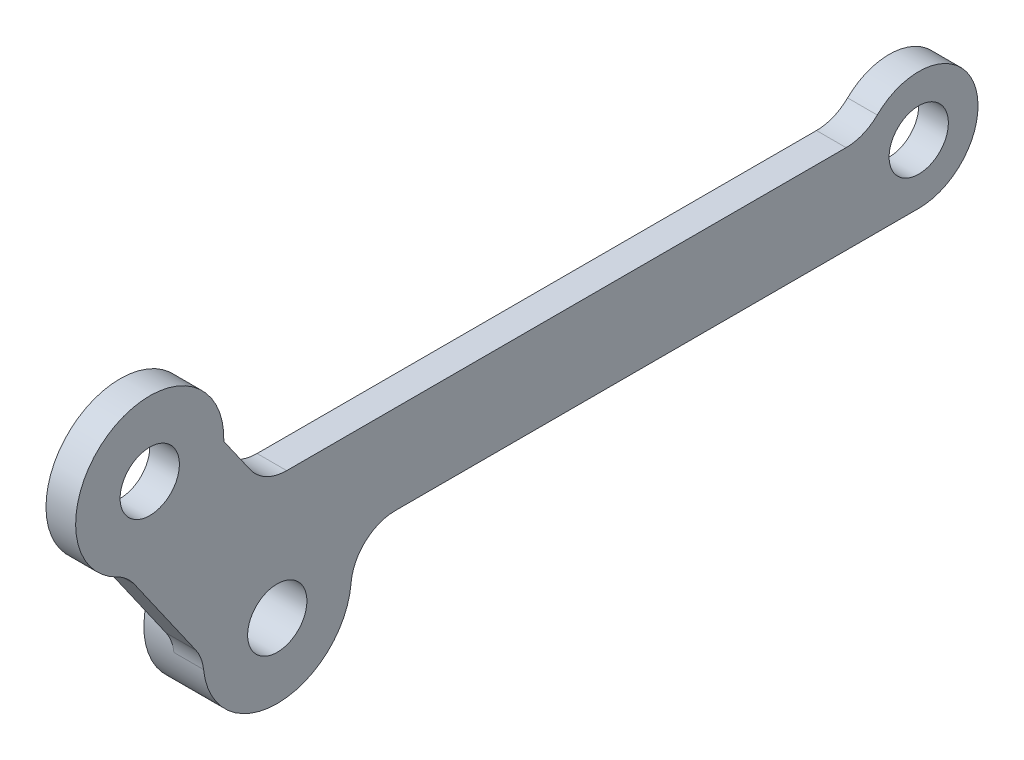
from build123d import *

# Parameters (mm, degrees)
EXTRUDE_1_DEPTH          = 2
EXTRUDE_START            = -2
SKETCH_1_4_R             = 5
EXTRUDE_2_DEPTH          = 2
CUT_EXTRUDE_1_DEPTH      = 51.040969284
CUT_EXTRUDE_1_DEPTH_BACK = 51.040969284
SKETCH_1_3_R             = 2
FILLET_1_R               = 3


with BuildPart() as part:
    # 草图1 → 凸台-拉伸1 (new body)
    with BuildSketch(Plane(origin=(0, 0, 0), x_dir=(0, 0, -1), z_dir=(1, 0, 0))):
        with BuildLine():
            Line((40.737143614, 0), (0, 0))
            Line((0, 0), (2.48051592, -3.542543867))
            ThreePointArc((2.48051592, -3.542543867), (4.165783411, -4.487079684), (5.367176995, -6))
            Line((5.367176995, -6), (44.201245229, -6))
            ThreePointArc((44.201245229, -6), (40.737143614, -4), (40.737143614, 0))
        make_face()
        with BuildLine():
            Line((2.48051592, -3.542543867), (0, 0))
            Line((0, 0), (-2.681672007, 3.829824531))
            ThreePointArc((-2.681672007, 3.829824531), (-4.811127311, -0.102785303), (-9.234888361, -0.758786959))
            Line((-9.234888361, -0.758786959), (-4.072700434, -8.131155358))
            ThreePointArc((-4.072700434, -8.131155358), (-1.94324513, -4.198545524), (2.48051592, -3.542543867))
        make_face()
        with BuildLine():
            ThreePointArc((48.201245229, -2), (45.23652141, 1.863703305), (40.737143614, 0))
            Line((40.737143614, 0), (44.201245229, 0))
            ThreePointArc((44.201245229, 0), (45.615458792, -0.585786438), (46.201245229, -2))
            ThreePointArc((46.201245229, -2), (45.615458792, -3.414213562), (44.201245229, -4))
            Line((44.201245229, -4), (44.201245229, -6))
            ThreePointArc((44.201245229, -6), (47.029672354, -4.828427125), (48.201245229, -2))
        make_face()
        with BuildLine():
            Line((44.201245229, 0), (40.737143614, 0))
            ThreePointArc((40.737143614, 0), (40.737143614, -4), (44.201245229, -6))
            Line((44.201245229, -6), (44.201245229, -4))
            ThreePointArc((44.201245229, -4), (42.201245229, -2), (44.201245229, 0))
        make_face()
        with BuildLine():
            ThreePointArc((5.367176995, -6), (4.165783411, -4.487079684), (2.48051592, -3.542543867))
            Line((2.48051592, -3.542543867), (4.201245229, -6))
            Line((4.201245229, -6), (5.367176995, -6))
        make_face()
        with BuildLine():
            Line((4.201245229, -6), (2.48051592, -3.542543867))
            ThreePointArc((2.48051592, -3.542543867), (-1.94324513, -4.198545524), (-4.072700434, -8.131155358))
            Line((-4.072700434, -8.131155358), (-2.351971125, -10.588611491))
            Line((-2.351971125, -10.588611491), (-0.713667036, -9.441458618))
            ThreePointArc((-0.713667036, -9.441458618), (-0.222515821, -6.656001657), (2.562941141, -7.147152873))
            Line((2.562941141, -7.147152873), (4.201245229, -6))
        make_face()
        with BuildLine():
            ThreePointArc((-9.234888361, -0.758786959), (-4.811127311, -0.102785303), (-2.681672007, 3.829824531))
            Line((-2.681672007, 3.829824531), (-4.402401316, 6.287280664))
            Line((-4.402401316, 6.287280664), (-6.040705405, 5.140127792))
            ThreePointArc((-6.040705405, 5.140127792), (-5.771575592, 4.594386518), (-5.679009493, 3.992974919))
            ThreePointArc((-5.679009493, 3.992974919), (-7.077597894, 2.085541017), (-9.317313582, 2.845822046))
            Line((-9.317313582, 2.845822046), (-10.95561767, 1.698669174))
            Line((-10.95561767, 1.698669174), (-9.234888361, -0.758786959))
        make_face()
        with BuildLine():
            Line((-4.402401316, 6.287280664), (-2.681672007, 3.829824531))
            ThreePointArc((-2.681672007, 3.829824531), (-2.679675166, 3.911388863), (-2.679009493, 3.992974919))
            ThreePointArc((-2.679009493, 3.992974919), (-10.613341245, 8.041394014), (-9.234888361, -0.758786959))
            Line((-9.234888361, -0.758786959), (-10.95561767, 1.698669174))
            Line((-10.95561767, 1.698669174), (-9.317313582, 2.845822046))
            ThreePointArc((-9.317313582, 2.845822046), (-8.826162366, 5.631279008), (-6.040705405, 5.140127792))
            Line((-6.040705405, 5.140127792), (-4.402401316, 6.287280664))
        make_face()
        with BuildLine():
            ThreePointArc((46.201245229, -2), (45.615458792, -0.585786438), (44.201245229, 0))
            Line((44.201245229, 0), (44.201245229, -4))
            ThreePointArc((44.201245229, -4), (45.615458792, -3.414213562), (46.201245229, -2))
        make_face()
        with BuildLine():
            Line((44.201245229, -4), (44.201245229, 0))
            ThreePointArc((44.201245229, 0), (42.201245229, -2), (44.201245229, -4))
        make_face()
        with BuildLine():
            Line((5.367176995, -6), (4.201245229, -6))
            Line((4.201245229, -6), (2.562941141, -7.147152873))
            ThreePointArc((2.562941141, -7.147152873), (2.832070954, -7.692894146), (2.924637052, -8.294305745))
            ThreePointArc((2.924637052, -8.294305745), (1.526048651, -10.201739647), (-0.713667036, -9.441458618))
            Line((-0.713667036, -9.441458618), (-2.351971125, -10.588611491))
            Line((-2.351971125, -10.588611491), (-4.072700434, -8.131155358))
            ThreePointArc((-4.072700434, -8.131155358), (0.843050996, -13.293640073), (5.924637052, -8.294305745))
            ThreePointArc((5.924637052, -8.294305745), (5.783273678, -7.113776143), (5.367176995, -6))
        make_face()
        with BuildLine():
            ThreePointArc((2.924637052, -8.294305745), (2.832070954, -7.692894146), (2.562941141, -7.147152873))
            Line((2.562941141, -7.147152873), (-0.713667036, -9.441458618))
            ThreePointArc((-0.713667036, -9.441458618), (1.526048651, -10.201739647), (2.924637052, -8.294305745))
        make_face()
        with BuildLine():
            Line((-0.713667036, -9.441458618), (2.562941141, -7.147152873))
            ThreePointArc((2.562941141, -7.147152873), (-0.222515821, -6.656001657), (-0.713667036, -9.441458618))
        make_face()
        with BuildLine():
            ThreePointArc((-5.679009493, 3.992974919), (-5.771575592, 4.594386518), (-6.040705405, 5.140127792))
            Line((-6.040705405, 5.140127792), (-9.317313582, 2.845822046))
            ThreePointArc((-9.317313582, 2.845822046), (-7.077597894, 2.085541017), (-5.679009493, 3.992974919))
        make_face()
        with BuildLine():
            Line((-9.317313582, 2.845822046), (-6.040705405, 5.140127792))
            ThreePointArc((-6.040705405, 5.140127792), (-8.826162366, 5.631279008), (-9.317313582, 2.845822046))
        make_face()
    extrude(amount=EXTRUDE_1_DEPTH)

    # 草图1<4> → 凸台-拉伸2 (add)
    with BuildSketch(Plane(origin=(0, 0, 0), x_dir=(0, 0, -1), z_dir=(1, 0, 0)).offset(EXTRUDE_START)):
        with Locations(Location((0.924637052, -8.294305745, 0), (0, 0, 178.130102354))):
            Circle(SKETCH_1_4_R)
    extrude(amount=EXTRUDE_2_DEPTH)

    # 草图1<3> → 切除-拉伸1 (cut, two sides: drawn at the far end of the back side and taken through both)
    with BuildSketch(Plane(origin=(0, 0, 0), x_dir=(0, 0, -1), z_dir=(1, 0, 0)).offset(-CUT_EXTRUDE_1_DEPTH_BACK)):
        with Locations((-7.679009493, 3.992974919)):
            Circle(SKETCH_1_3_R)
        with Locations((44.201245229, -2)):
            Circle(SKETCH_1_3_R)
        with Locations((0.924637052, -8.294305745)):
            Circle(SKETCH_1_3_R)
    extrude(amount=CUT_EXTRUDE_1_DEPTH + CUT_EXTRUDE_1_DEPTH_BACK, mode=Mode.SUBTRACT)

    # 圆角1
    # the kernel refuses this fillet: 3 mm, written as the material it adds along each edge
    with BuildSketch(Plane(origin=(0, -6, -5.367176995), x_dir=(0, 0, -1), z_dir=(1, 0, 0))) as fillet_1_piece_1:
        with BuildLine():
            CenterArc((3.526273997, -3), FILLET_1_R, 90, 84.939259464)
            ThreePointArc((0.53796877, -2.735364655), (0.463478447, -1.329430853), (0, 0))
            Line((0, 0), (3.526273997, 0))
        make_face()
    extrude(amount=2)
    with BuildSketch(Plane(origin=(0, 0, 0), x_dir=(0, 0, -1), z_dir=(1, 0, 0))) as fillet_1_piece_2:
        with BuildLine():
            CenterArc((FILLET_1_R * 0.520567050552, FILLET_1_R), FILLET_1_R, 215, 55)
            Line((-FILLET_1_R * 0.298584993737, FILLET_1_R * 0.426423563649), (0, 0))
            Line((0, 0), (FILLET_1_R * 0.520567050552, 0))
        make_face()
    extrude(amount=2)
    with BuildSketch(Plane(origin=(0, 0, -40.737143614), x_dir=(0, 0.790236885240252, -0.6128014892326752), z_dir=(1, 0, 0))) as fillet_1_piece_3:
        with BuildLine():
            CenterArc((1.49141536, 2.972297887), FILLET_1_R, 217.792345701, 44.415308597)
            Line((-0.879295296, 1.133893419), (0, 0))
            ThreePointArc((0, 0), (0.542332858, 0.036936151), (1.084665716, 0))
        make_face()
    extrude(amount=2)
    with BuildSketch(Plane(origin=(0, -0.758786959, 9.234888361), x_dir=(0, -0.8191520442889745, -0.5735764363510707), z_dir=(1, 0, 0))) as fillet_1_piece_4:
        with BuildLine():
            CenterArc((0.872983346, -3), FILLET_1_R, 90, 28.955024372)
            ThreePointArc((-0.579385409, -0.375), (-0.283214788, -0.19750856), (0, 0))
            Line((0, 0), (0.872983346, 0))
        make_face()
    extrude(amount=2)
    with BuildSketch(Plane(origin=(0, -8.131155358, 4.072700434), x_dir=(0, -0.9993363396246481, -0.03642636827368134), z_dir=(1, 0, 0))) as fillet_1_piece_5:
        with BuildLine():
            CenterArc((0.897200113, -2.992846785), FILLET_1_R, 93.957436637, 28.955024372)
            Line((-0.732871014, -0.474341649), (0, 0))
            ThreePointArc((0, 0), (0.345076967, -0.011922025), (0.690153933, 0))
        make_face()
    extrude(amount=2)


solid = part.part
